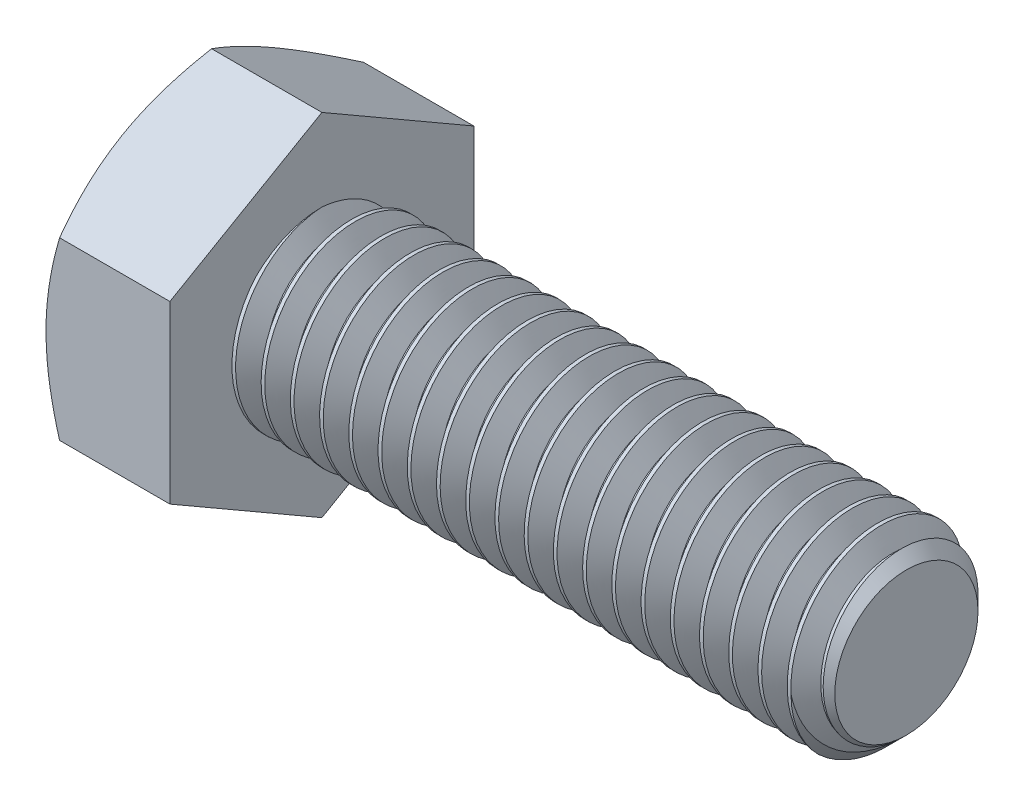
from build123d import *

# Parameters (mm, degrees)
SKETCH2_R           = 4
BOSS_EXTRUDE1_DEPTH = 25
CHAMFER1_SIZE       = 0.9375
CUT_SWEEP1_PITCH    = 1.25
BOSS_EXTRUDE2_DEPTH = 5.3
SKETCH6_OUTSIDE_W   = 136.164
SKETCH6_OUTSIDE_H   = 138.176
SKETCH6_OUTSIDE_R   = 6.5
CUT_EXTRUDE1_DEPTH  = 32.885315463
CUT_EXTRUDE1_DRAFT  = -60
SKETCH7_W           = 0.263417301
SKETCH7_H           = 0.263417301
CUT_EXTRUDE2_DEPTH  = 0.25


with BuildPart() as part:
    # Sketch2 → Boss-Extrude1 (new body)
    with BuildSketch(Plane(origin=(15.15, 0, 0), x_dir=(0, 0, -1), z_dir=(1, 0, 0))):
        Circle(SKETCH2_R)
    extrude(amount=-BOSS_EXTRUDE1_DEPTH)

    # Chamfer1
    chamfer1_edges = [part.edges().sort_by_distance(p)[0] for p in [
        (15.15, 0, 4),
    ]]
    chamfer(chamfer1_edges, length=CHAMFER1_SIZE)

    # Cut-Sweep1: arcs per turn and ends read off the stored shape
    # Cut-Sweep1: the profile of Sketch5 profile screwed along a right-hand helix through 21 turns, 8 arcs to a turn; built about Z, then put on its axis
    cut_sweep1_z = Axis((0, 0, 0), (0, 0, 1))
    cut_sweep1_corners = [(4.0003, 0, 0.000173205), (3.188101184, 0, -0.46875), (3.188101184, 0, -0.625), (4.0003, 0, -1.093923205)]
    with BuildLine(mode=Mode.PRIVATE) as cut_sweep1_profile:
        Line(cut_sweep1_corners[0], cut_sweep1_corners[1])
        Line(cut_sweep1_corners[1], cut_sweep1_corners[2])
        Line(cut_sweep1_corners[2], cut_sweep1_corners[3])
        Line(cut_sweep1_corners[3], cut_sweep1_corners[0])
    cut_sweep1_cap = Face(cut_sweep1_profile.wire())
    cut_sweep1_turn_angles = [0, 22.5, 45, 67.5, 90, 112.5, 135, 157.5, 180, 202.5, 225, 247.5, 270, 292.5, 315, 337.5, 360]
    cut_sweep1_turn_weights = [1, 0.9238795325112867, 1, 0.9238795325112867, 1, 0.9238795325112867, 1, 0.9238795325112867, 1, 0.9238795325112867, 1, 0.9238795325112867, 1, 0.9238795325112867, 1, 0.9238795325112867, 1]
    cut_sweep1_turn_rails = [Edge.make_bspline([Vector(p[0], p[1], 0).rotate(cut_sweep1_z, cut_sweep1_turn_angles[k]) / cut_sweep1_turn_weights[k] + Vector(0, 0, p[2] + CUT_SWEEP1_PITCH * cut_sweep1_turn_angles[k] / 360) for k in range(17)], [0, 0, 0, 1, 1, 2, 2, 3, 3, 4, 4, 5, 5, 6, 6, 7, 7, 8, 8, 8], 2, cut_sweep1_turn_weights) for p in cut_sweep1_corners]
    cut_sweep1_turn_sides = [Face.make_surface_from_curves(cut_sweep1_turn_rails[p[0]], cut_sweep1_turn_rails[p[1]]) for p in [(0, 1), (1, 2), (2, 3), (3, 0)]]
    cut_sweep1 = Plane(origin=(15.15, 0, 0), x_dir=(0, 1, 0), z_dir=(-1, 0, 0)) * Solid(Shell([*[p.moved(Location((0, 0, CUT_SWEEP1_PITCH * i))) for i in range(21) for p in cut_sweep1_turn_sides], cut_sweep1_cap, cut_sweep1_cap.rotate(cut_sweep1_z, 7560).moved(Location((0, 0, CUT_SWEEP1_PITCH * 7560 / 360)))]))
    add(cut_sweep1, mode=Mode.SUBTRACT)

    # Sketch3 → Boss-Extrude2 (add)
    with BuildSketch(Plane.ZY.offset(9.85)):
        Polygon((-6.5, -3.75277675), (0, -7.505553499), (6.5, -3.75277675), (6.5, 3.75277675), (0, 7.505553499), (-6.5, 3.75277675), align=None)
    extrude(amount=BOSS_EXTRUDE2_DEPTH)


with BuildPart() as cut_extrude1_tool:
    # Sketch6 outside → Cut-Extrude1 (with draft: the straight prism first)
    with BuildSketch(Plane.ZY.offset(15.15)):
        Rectangle(SKETCH6_OUTSIDE_W, SKETCH6_OUTSIDE_H)
        Circle(SKETCH6_OUTSIDE_R, mode=Mode.SUBTRACT)
    extrude(amount=-CUT_EXTRUDE1_DEPTH)
    # Cut-Extrude1: the draft: its side faces are tilted about the plane it starts from
    cut_extrude1_sides = [cut_extrude1_tool.faces().sort_by_distance(p)[0] for p in [
        (1.292657732, -69.088, 0),
        (1.292657732, 0, 68.082),
        (1.292657732, 69.088, 0),
        (1.292657732, 0, -68.082),
        (1.292657732, 0, -6.5),
    ]]
    draft(cut_extrude1_sides, Plane.ZY.offset(15.15), CUT_EXTRUDE1_DRAFT)


with BuildPart() as part_1:
    add(part.part)

    # Cut-Extrude1: cut by cut_extrude1_tool
    add(cut_extrude1_tool.part, mode=Mode.SUBTRACT)

    # Sketch7 → Cut-Extrude2 (cut)
    # profile 1 of 4: a face of its own
    with BuildSketch(Plane.ZY.offset(15.15)):
        with BuildLine():
            Line((-1.712212457, 3.25), (-1.975629758, 3.25))
            Line((-1.975629758, 3.25), (-1.975629758, 4.851083283))
            add(Edge.make_bspline(
                [(-1.975629758, 4.851083283), (-1.990797349, 4.836456007), (-2.022321526, 4.806054817), (-2.075609816, 4.763029542), (-2.135086359, 4.719421601), (-2.199978812, 4.677487692), (-2.266125691, 4.638011438), (-2.330048133, 4.602508617), (-2.390678926, 4.572464616), (-2.430616757, 4.556036438), (-2.449780899, 4.548153387)],
                knots=[0, 0, 0, 0, 0.893362401, 1.856755847, 2.901947673, 4.020460078, 5.132200827, 6.168787962, 7.121294059, 8, 8, 8, 8], degree=3))
            Line((-2.449780899, 4.548153387), (-2.449780899, 4.790991211))
            add(Edge.make_bspline(
                [(-2.449780899, 4.790991211), (-2.416864504, 4.807943221), (-2.351988236, 4.841354628), (-2.260332099, 4.899060722), (-2.174761236, 4.961616503), (-2.096692183, 5.029008122), (-2.026708251, 5.097894454), (-1.967731776, 5.167403469), (-1.918384014, 5.234987266), (-1.893625307, 5.28211947), (-1.881787344, 5.304654948)],
                knots=[0, 0, 0, 0, 1.141258006, 2.249351951, 3.335817539, 4.406819942, 5.426913362, 6.360259544, 7.215985427, 8, 8, 8, 8], degree=3))
            Line((-1.881787344, 5.304654948), (-1.712212457, 5.304654948))
            Line((-1.712212457, 5.304654948), (-1.712212457, 3.25))
        make_face()
    # profile 2 of 4: a face of its own
    with BuildSketch(Plane.ZY.offset(15.15)):
        with BuildLine():
            add(Edge.make_bspline(
                [(-1.053669204, 4.26333343), (-1.053403811, 4.292696335), (-1.052884018, 4.350205901), (-1.04965991, 4.434352728), (-1.044030879, 4.514263485), (-1.035628286, 4.589868774), (-1.025678041, 4.66133925), (-1.01274266, 4.728572918), (-0.998188475, 4.791720628), (-0.980726066, 4.850716558), (-0.961540595, 4.906067965), (-0.939774065, 4.957686055), (-0.915283767, 5.005516098), (-0.889273246, 5.05005412), (-0.860373255, 5.090607372), (-0.830328139, 5.128313943), (-0.796954399, 5.161790986), (-0.761639786, 5.191899869), (-0.723864284, 5.218469203), (-0.683827763, 5.241395334), (-0.641684272, 5.261637455), (-0.596630603, 5.276875718), (-0.549602061, 5.289298133), (-0.500236646, 5.298436212), (-0.448479956, 5.303823417), (-0.413111534, 5.30437464), (-0.395125952, 5.304654948)],
                knots=[0, 0, 0, 0, 1.514747001, 2.966751498, 4.343369068, 5.64627492, 6.890416844, 8.064737671, 9.177176366, 10.232018008, 11.237056675, 12.19799043, 13.119080079, 14.007588942, 14.855863561, 15.685992447, 16.491747269, 17.290132607, 18.077525251, 18.870243746, 19.668095604, 20.485086593, 21.319398728, 22.175900658, 23.072407314, 24, 24, 24, 24], degree=3))
            add(Edge.make_bspline(
                [(-0.395125952, 5.304654948), (-0.368738762, 5.303879183), (-0.316900071, 5.302355162), (-0.241215314, 5.289925525), (-0.169887308, 5.268662714), (-0.102962395, 5.239978266), (-0.041584646, 5.203543495), (0.01322827, 5.159251481), (0.060885109, 5.107567279), (0.100865769, 5.04787845), (0.135812857, 4.981831611), (0.166859083, 4.909130317), (0.194923969, 4.82985604), (0.214839423, 4.758894496), (0.2290451, 4.697637972), (0.23844813, 4.647115325), (0.246254529, 4.592601104), (0.252235287, 4.534227193), (0.257142357, 4.472059066), (0.260931862, 4.406058014), (0.262855424, 4.336059078), (0.263226498, 4.28802977), (0.263417301, 4.26333343)],
                knots=[0, 0, 0, 0, 1.134486744, 2.228744715, 3.287356444, 4.328707449, 5.352829806, 6.347195599, 7.349461267, 8.364207941, 9.428085653, 10.559314403, 11.761222316, 13.04268526, 13.726896727, 14.465273606, 15.252205015, 16.094778733, 16.988606776, 17.934225168, 18.937792761, 20, 20, 20, 20], degree=3))
            add(Edge.make_bspline(
                [(0.263417301, 4.26333343), (0.263146937, 4.234108446), (0.262618727, 4.177011689), (0.259481011, 4.093539578), (0.253512791, 4.014231709), (0.246168788, 3.93890641), (0.23505885, 3.867764764), (0.223087289, 3.80050451), (0.208281426, 3.737431068), (0.191006459, 3.678516795), (0.171550924, 3.623450173), (0.15021492, 3.57181504), (0.126583246, 3.523646677), (0.099952535, 3.479414897), (0.071541263, 3.438532594), (0.041141347, 3.400846412), (0.008108274, 3.366898762), (-0.027524579, 3.336880189), (-0.065034849, 3.309839686), (-0.105168706, 3.286687205), (-0.147750491, 3.267505776), (-0.192495698, 3.251106608), (-0.239858332, 3.239090259), (-0.289464895, 3.229891932), (-0.341498164, 3.224475291), (-0.377003388, 3.223934368), (-0.395125952, 3.22365827)],
                knots=[0, 0, 0, 0, 1.508974709, 2.94807912, 4.311757619, 5.615040294, 6.854280449, 8.028314546, 9.141715822, 10.197470207, 11.196696834, 12.155719058, 13.080757287, 13.963948316, 14.818758719, 15.649605906, 16.461113142, 17.260189315, 18.052359509, 18.845763934, 19.647754795, 20.461145776, 21.303032214, 22.167241874, 23.064524267, 24, 24, 24, 24], degree=3))
            add(Edge.make_bspline(
                [(-0.395125952, 3.22365827), (-0.418886733, 3.224336047), (-0.465213718, 3.225657527), (-0.532870864, 3.234636168), (-0.596370704, 3.250438997), (-0.656248823, 3.271632819), (-0.711832175, 3.299980776), (-0.763386148, 3.334471601), (-0.811946681, 3.37430283), (-0.839901077, 3.405728755), (-0.854048281, 3.421632835)],
                knots=[0, 0, 0, 0, 1.10322584, 2.150986741, 3.161425019, 4.136713905, 5.093944212, 6.049774532, 7.013026876, 8, 8, 8, 8], degree=3))
            add(Edge.make_bspline(
                [(-0.854048281, 3.421632835), (-0.870332038, 3.445122393), (-0.903909841, 3.493558868), (-0.943209749, 3.57614755), (-0.978265963, 3.667066094), (-1.005778664, 3.76809831), (-1.027327966, 3.878440095), (-1.042891943, 3.998307965), (-1.051699622, 4.127650132), (-1.052997856, 4.217084674), (-1.053669204, 4.26333343)],
                knots=[0, 0, 0, 0, 0.779365345, 1.607084704, 2.489375761, 3.438383567, 4.461919411, 5.557722155, 6.737039282, 8, 8, 8, 8], degree=3))
        make_face()
        with BuildLine():
            add(Edge.make_bspline(
                [(-0.790251903, 4.264156609), (-0.789990351, 4.224638121), (-0.789489681, 4.148990994), (-0.784258903, 4.040916022), (-0.775254335, 3.943417645), (-0.763349706, 3.856630855), (-0.747630777, 3.780438257), (-0.727893802, 3.715034013), (-0.705645537, 3.659633124), (-0.678113731, 3.61492224), (-0.647969444, 3.578476348), (-0.616847528, 3.547131701), (-0.584015791, 3.52048947), (-0.549688457, 3.498275282), (-0.513332913, 3.481456158), (-0.4753467, 3.46926562), (-0.435721553, 3.462250153), (-0.408735027, 3.461242162), (-0.395125952, 3.460733841)],
                knots=[0, 0, 0, 0, 1.89448813, 3.626469325, 5.185477471, 6.587276848, 7.82441448, 8.910550357, 9.859733512, 10.6775885, 11.416198291, 12.123144072, 12.791880183, 13.439617036, 14.078171869, 14.70637855, 15.347637704, 16, 16, 16, 16], degree=3))
            add(Edge.make_bspline(
                [(-0.395125952, 3.460733841), (-0.381520284, 3.461253269), (-0.354540516, 3.462283284), (-0.314823811, 3.469144054), (-0.276985394, 3.481962153), (-0.240684056, 3.498721871), (-0.206107221, 3.520429731), (-0.17343673, 3.547172596), (-0.14215087, 3.578498631), (-0.11214199, 3.615368141), (-0.084819938, 3.660285738), (-0.062154323, 3.715641498), (-0.042724938, 3.781160284), (-0.026919756, 3.857314062), (-0.014966019, 3.943963635), (-0.006015893, 4.041191596), (-0.000750109, 4.149127511), (-0.000257703, 4.224637943), (0, 4.264156609)],
                knots=[0, 0, 0, 0, 0.652509534, 1.29391342, 1.924290653, 2.562989607, 3.207355802, 3.876242846, 4.583348185, 5.32723334, 6.150888545, 7.094226006, 8.186903555, 9.424320409, 10.81992305, 12.379283064, 14.105084285, 16, 16, 16, 16], degree=3))
            add(Edge.make_bspline(
                [(0, 4.264156609), (-0.000249452, 4.30285302), (-0.000727391, 4.376993878), (-0.006128987, 4.482986783), (-0.014593772, 4.57884869), (-0.026172254, 4.664667974), (-0.041560054, 4.740351467), (-0.060223356, 4.806060288), (-0.082463471, 4.861654304), (-0.108906889, 4.907691956), (-0.138343703, 4.94545532), (-0.169093247, 4.978142798), (-0.201924261, 5.005942433), (-0.237418413, 5.02824371), (-0.274431658, 5.046235551), (-0.313814468, 5.058617994), (-0.35517974, 5.06622538), (-0.38356819, 5.067122888), (-0.398007078, 5.067579377)],
                knots=[0, 0, 0, 0, 1.850066095, 3.544656626, 5.0727657, 6.45041401, 7.682899467, 8.762389858, 9.712573485, 10.538438529, 11.291566246, 11.996865408, 12.681389046, 13.341983376, 13.996294293, 14.643563182, 15.31009126, 16, 16, 16, 16], degree=3))
            add(Edge.make_bspline(
                [(-0.398007078, 5.067579377), (-0.411615299, 5.067222215), (-0.438448966, 5.066517937), (-0.47773697, 5.059795612), (-0.514969749, 5.048554386), (-0.550573872, 5.033327055), (-0.583660499, 5.012834074), (-0.615541766, 4.98890706), (-0.644724475, 4.959754665), (-0.66230972, 4.93796079), (-0.671302528, 4.926815757)],
                knots=[0, 0, 0, 0, 1.021318143, 2.013908504, 2.982026795, 3.937174072, 4.91255697, 5.897578595, 6.924855925, 8, 8, 8, 8], degree=3))
            add(Edge.make_bspline(
                [(-0.671302528, 4.926815757), (-0.681092952, 4.910447155), (-0.701768267, 4.875880115), (-0.724902742, 4.815801176), (-0.745338823, 4.747142384), (-0.762164493, 4.668847374), (-0.774336685, 4.581050453), (-0.78394616, 4.483853581), (-0.788937924, 4.37712106), (-0.789801826, 4.302850334), (-0.790251903, 4.264156609)],
                knots=[0, 0, 0, 0, 0.671104906, 1.417232262, 2.260109084, 3.195198885, 4.23592645, 5.382417421, 6.636286093, 8, 8, 8, 8], degree=3))
        make_face(mode=Mode.SUBTRACT)
    # profile 3 of 4: a face of its own
    with BuildSketch(Plane.ZY.offset(15.15)):
        with Locations((0.790251904, 3.381708651)):
            Rectangle(SKETCH7_W, SKETCH7_H)
    # profile 4 of 4: a face of its own
    with BuildSketch(Plane.ZY.offset(15.15)):
        with BuildLine():
            Line((1.343428235, 3.750492872), (1.606845536, 3.776834602))
            add(Edge.make_bspline(
                [(1.606845536, 3.776834602), (1.609226986, 3.763338136), (1.61383053, 3.737248323), (1.624219278, 3.700065869), (1.634756016, 3.665396831), (1.648357527, 3.634013553), (1.662522508, 3.605063578), (1.678563961, 3.578837007), (1.69676769, 3.555860592), (1.722473745, 3.52893633), (1.758946895, 3.500840405), (1.809503625, 3.478081611), (1.865120776, 3.462779267), (1.904315553, 3.461431235), (1.924592656, 3.460733841)],
                knots=[0, 0, 0, 0, 0.994516507, 1.922484754, 2.80151264, 3.623050913, 4.402748861, 5.140924173, 5.850441436, 6.526872911, 7.841975818, 9.161260782, 10.53140107, 12, 12, 12, 12], degree=3))
            add(Edge.make_bspline(
                [(1.924592656, 3.460733841), (1.942335318, 3.46137277), (1.977255627, 3.462630282), (2.028170595, 3.472378616), (2.076589938, 3.487995243), (2.121670811, 3.510401832), (2.163249141, 3.537670026), (2.199566411, 3.570070133), (2.231107568, 3.606206721), (2.257012656, 3.647843004), (2.279123348, 3.695398627), (2.300015011, 3.7494784), (2.319778178, 3.811014023), (2.337342519, 3.879220631), (2.353070526, 3.951608123), (2.36410829, 4.026536277), (2.370899396, 4.102548373), (2.37162589, 4.153699284), (2.371990478, 4.179369165)],
                knots=[0, 0, 0, 0, 0.897794352, 1.766998465, 2.614902619, 3.466100941, 4.308008728, 5.124841802, 5.922729683, 6.728261092, 7.598214292, 8.574707161, 9.662086263, 10.868425066, 12.139522319, 13.41071447, 14.70057738, 16, 16, 16, 16], degree=3))
            add(Edge.make_bspline(
                [(2.371990478, 4.179369165), (2.371865792, 4.186366486), (2.371567489, 4.203107167), (2.371054359, 4.219842715), (2.370755709, 4.229583088)],
                knots=[0, 0, 0, 0, 0.835966126, 2, 2, 2, 2], degree=3))
            add(Edge.make_bspline(
                [(2.370755709, 4.229583088), (2.358056779, 4.21029884), (2.332679381, 4.171761418), (2.285927945, 4.120039532), (2.232443482, 4.074161517), (2.173037847, 4.03448362), (2.109177907, 4.001920759), (2.041974623, 3.978259264), (1.972007314, 3.963648603), (1.924388684, 3.962040101), (1.900308873, 3.961226713)],
                knots=[0, 0, 0, 0, 0.978840568, 1.956103883, 2.947027447, 3.962820877, 4.980997961, 5.980964245, 6.979013046, 8, 8, 8, 8], degree=3))
            add(Edge.make_bspline(
                [(1.900308873, 3.961226713), (1.880242283, 3.961746616), (1.840740816, 3.962770056), (1.782878116, 3.971866063), (1.72722554, 3.985506849), (1.674310458, 4.00615966), (1.623309587, 4.031701873), (1.574758435, 4.063052981), (1.528582191, 4.100170311), (1.485377524, 4.142591689), (1.445949465, 4.189875867), (1.411178467, 4.240870912), (1.382304678, 4.295826174), (1.358280685, 4.35405573), (1.339743646, 4.416122198), (1.32686283, 4.48188015), (1.318199864, 4.551078568), (1.317462547, 4.598477128), (1.317086505, 4.622651092)],
                knots=[0, 0, 0, 0, 0.975490236, 1.920271282, 2.842894855, 3.757591483, 4.67685385, 5.613562631, 6.563069669, 7.554119451, 8.55387214, 9.553424333, 10.550567425, 11.568071726, 12.613215376, 13.695622473, 14.824733476, 16, 16, 16, 16], degree=3))
            add(Edge.make_bspline(
                [(1.317086505, 4.622651092), (1.317649718, 4.647643937), (1.318751461, 4.696534277), (1.327073801, 4.768018026), (1.340842359, 4.835739983), (1.360921901, 4.899570884), (1.385753581, 4.95992086), (1.417065367, 5.016354799), (1.453651568, 5.069114111), (1.495730787, 5.117690149), (1.541975466, 5.161276301), (1.591073928, 5.200177701), (1.643665963, 5.232154466), (1.698743165, 5.25881511), (1.756722343, 5.279418859), (1.817504403, 5.294311039), (1.88125754, 5.303049305), (1.924702865, 5.304113318), (1.94681849, 5.304654948)],
                knots=[0, 0, 0, 0, 1.151671969, 2.252870106, 3.311924673, 4.331900944, 5.332425074, 6.314476151, 7.300265758, 8.286521684, 9.270545387, 10.225535917, 11.167946231, 12.101233205, 13.04124339, 13.998220545, 14.981004193, 16, 16, 16, 16], degree=3))
            add(Edge.make_bspline(
                [(1.94681849, 5.304654948), (1.962880806, 5.304330093), (1.99480732, 5.30368439), (2.0423206, 5.298754658), (2.088708773, 5.289868011), (2.134274283, 5.278650564), (2.178248567, 5.263079902), (2.221479299, 5.245074026), (2.263445052, 5.223051477), (2.304390355, 5.198009079), (2.344058042, 5.170387031), (2.3805546, 5.138652287), (2.415338776, 5.104974281), (2.447702759, 5.068296042), (2.476622878, 5.028051504), (2.504062511, 4.985663509), (2.52869893, 4.940207137), (2.551165634, 4.891620825), (2.571161871, 4.838904439), (2.587843743, 4.780893002), (2.602143829, 4.717385587), (2.614050061, 4.648298015), (2.622878726, 4.573679539), (2.629376108, 4.493641057), (2.633629665, 4.408121689), (2.633988336, 4.349223752), (2.63417301, 4.318898017)],
                knots=[0, 0, 0, 0, 0.850689348, 1.69088598, 2.526071361, 3.350886897, 4.173587108, 4.994166539, 5.82944675, 6.680632524, 7.535501428, 8.385942454, 9.238956306, 10.098905971, 10.972410977, 11.861345628, 12.77184846, 13.708225841, 14.694799433, 15.754852217, 16.902446579, 18.141290626, 19.466225842, 20.880733292, 22.39393263, 24, 24, 24, 24], degree=3))
            add(Edge.make_bspline(
                [(2.63417301, 4.318898017), (2.6339871, 4.287200532), (2.633624768, 4.225423409), (2.629337817, 4.135244488), (2.622843702, 4.049998487), (2.614008798, 3.969629425), (2.602019565, 3.894259963), (2.587769409, 3.823903275), (2.570963778, 3.758429473), (2.551214715, 3.697832808), (2.528763845, 3.641416901), (2.504164324, 3.588487072), (2.476614223, 3.539121596), (2.446423095, 3.493225799), (2.413978613, 3.450719463), (2.37877421, 3.411716455), (2.340798452, 3.376334676), (2.300535409, 3.344175938), (2.258045506, 3.315836014), (2.213907178, 3.290829556), (2.167622297, 3.27034489), (2.119666686, 3.253540006), (2.070125559, 3.239664847), (2.018595398, 3.23031574), (1.965314272, 3.225020725), (1.929268891, 3.224116369), (1.911010201, 3.22365827)],
                knots=[0, 0, 0, 0, 1.538356107, 2.998194159, 4.380716326, 5.687456969, 6.921258146, 8.08355215, 9.170518603, 10.200253214, 11.174652363, 12.115998813, 13.031191965, 13.915860606, 14.780247615, 15.624154577, 16.462764255, 17.29681422, 18.1223677, 18.939254916, 19.756006416, 20.575278551, 21.404021733, 22.250368457, 23.113728878, 24, 24, 24, 24], degree=3))
            add(Edge.make_bspline(
                [(1.911010201, 3.22365827), (1.891643664, 3.223993119), (1.853752955, 3.224648253), (1.798436419, 3.231537028), (1.745740074, 3.242010212), (1.695817287, 3.257471112), (1.648294181, 3.276503064), (1.603981885, 3.300824816), (1.562092911, 3.328884843), (1.523144042, 3.361248996), (1.487591314, 3.397798428), (1.45542289, 3.437632363), (1.42722066, 3.481266718), (1.403132215, 3.528444239), (1.381795442, 3.57876802), (1.365253639, 3.632912869), (1.351815016, 3.690379413), (1.346268973, 3.730131475), (1.343428235, 3.750492872)],
                knots=[0, 0, 0, 0, 1.08199657, 2.11693069, 3.111083497, 4.081436044, 5.034173265, 5.967546613, 6.901297947, 7.84883568, 8.792454994, 9.747011506, 10.706361727, 11.690764787, 12.70483191, 13.757514363, 14.851376857, 16, 16, 16, 16], degree=3))
        make_face()
        with BuildLine():
            add(Edge.make_bspline(
                [(2.370755709, 4.628413345), (2.370459446, 4.644889997), (2.369882788, 4.676960744), (2.364830564, 4.723751563), (2.356701567, 4.767814617), (2.345291922, 4.809403273), (2.329797284, 4.848076676), (2.311847803, 4.884737747), (2.289897393, 4.918370349), (2.26513021, 4.949427371), (2.237848658, 4.97720716), (2.208139299, 5.001428652), (2.176559161, 5.022191962), (2.142350633, 5.038517507), (2.106638259, 5.051969698), (2.068564179, 5.060761527), (2.028652287, 5.066920378), (2.00117341, 5.06735675), (1.987154265, 5.067579377)],
                knots=[0, 0, 0, 0, 1.20361398, 2.342757417, 3.433960756, 4.474970456, 5.487648377, 6.473933575, 7.452701285, 8.415527761, 9.372491588, 10.291530068, 11.211879743, 12.12647906, 13.055739058, 13.994253148, 14.97671008, 16, 16, 16, 16], degree=3))
            add(Edge.make_bspline(
                [(1.987154265, 5.067579377), (1.972734284, 5.067142412), (1.944326885, 5.066281591), (1.902690191, 5.060737863), (1.863202918, 5.050123331), (1.82559848, 5.036043394), (1.789459226, 5.018626761), (1.756098961, 4.995805648), (1.724120441, 4.969943671), (1.694806273, 4.939940334), (1.668028748, 4.907044916), (1.644434797, 4.871566178), (1.624565701, 4.833486737), (1.608682838, 4.792965357), (1.595702867, 4.750355226), (1.58678655, 4.705275342), (1.581300213, 4.657773697), (1.580773232, 4.625273277), (1.580503806, 4.608657048)],
                knots=[0, 0, 0, 0, 1.007165334, 1.984118292, 2.925321257, 3.856078893, 4.785899085, 5.718627206, 6.671847665, 7.654235469, 8.641842333, 9.630378272, 10.624608936, 11.635186472, 12.665777387, 13.731187195, 14.840042241, 16, 16, 16, 16], degree=3))
            add(Edge.make_bspline(
                [(1.580503806, 4.608657048), (1.580752641, 4.593818186), (1.58124051, 4.564724947), (1.587050486, 4.522266014), (1.594800132, 4.481742842), (1.607154533, 4.443569068), (1.622037996, 4.407190484), (1.641381922, 4.373442578), (1.66316134, 4.341316222), (1.688680145, 4.311887654), (1.716891239, 4.285190782), (1.74770348, 4.261921586), (1.780727677, 4.242002749), (1.81627064, 4.225970909), (1.854119219, 4.213624034), (1.894188934, 4.204534243), (1.936653958, 4.199120139), (1.965735789, 4.198578529), (1.980568832, 4.198302284)],
                knots=[0, 0, 0, 0, 1.102204012, 2.160993585, 3.181057555, 4.164839289, 5.138418409, 6.097303793, 7.050641095, 8.019669129, 8.986440483, 9.932879371, 10.884360123, 11.847412593, 12.824617322, 13.839006415, 14.897795988, 16, 16, 16, 16], degree=3))
            add(Edge.make_bspline(
                [(1.980568832, 4.198302284), (1.994442526, 4.198581229), (2.021749061, 4.199130255), (2.061750264, 4.204567439), (2.099758927, 4.213674087), (2.135945704, 4.226054959), (2.170251941, 4.242081256), (2.202446951, 4.262158383), (2.233153085, 4.285161675), (2.261470231, 4.312039898), (2.287351065, 4.341799347), (2.309733175, 4.37473402), (2.328846295, 4.410245813), (2.343890266, 4.448755659), (2.355939774, 4.489789433), (2.364423428, 4.533606928), (2.369979224, 4.580114604), (2.370492966, 4.612070273), (2.370755709, 4.628413345)],
                knots=[0, 0, 0, 0, 1.017004716, 2.00169281, 2.953445817, 3.879374072, 4.80207141, 5.723561102, 6.657273834, 7.611045633, 8.581233951, 9.544037932, 10.525327521, 11.53237926, 12.57032081, 13.657564536, 14.802009319, 16, 16, 16, 16], degree=3))
        make_face(mode=Mode.SUBTRACT)
    extrude(amount=-CUT_EXTRUDE2_DEPTH, mode=Mode.SUBTRACT)


solid = part_1.part
